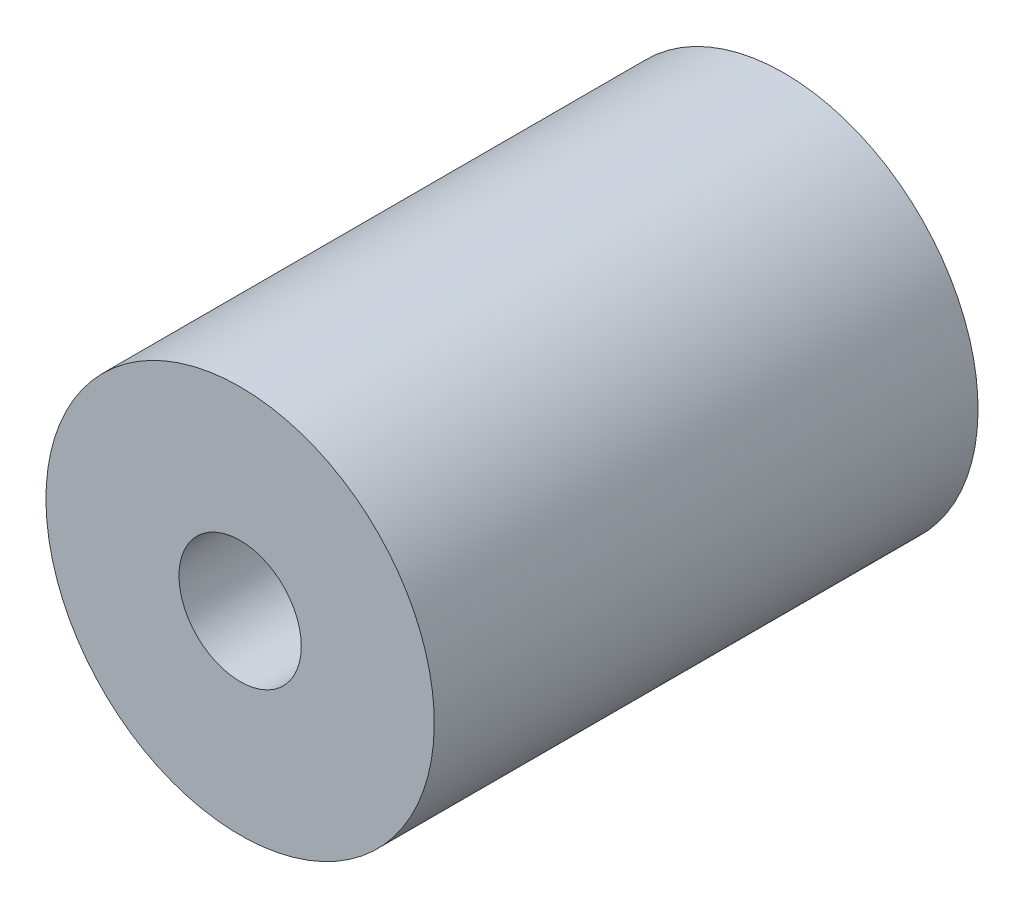
from build123d import *

# Parameters (mm, degrees)
SKETCH1_R           = 9.525
BOSS_EXTRUDE1_DEPTH = 26.675
SKETCH2_R           = 3
CUT_EXTRUDE1_DEPTH  = 30.883220626


with BuildPart() as part:
    # Sketch1 → Boss-Extrude1 (new body)
    with BuildSketch(Plane.XY):
        Circle(SKETCH1_R)
    extrude(amount=BOSS_EXTRUDE1_DEPTH)

    # Sketch2 → Cut-Extrude1 (cut, through all)
    with BuildSketch(Plane.XY.offset(26.675)):
        Circle(SKETCH2_R)
    extrude(amount=-CUT_EXTRUDE1_DEPTH, mode=Mode.SUBTRACT)


solid = part.part
